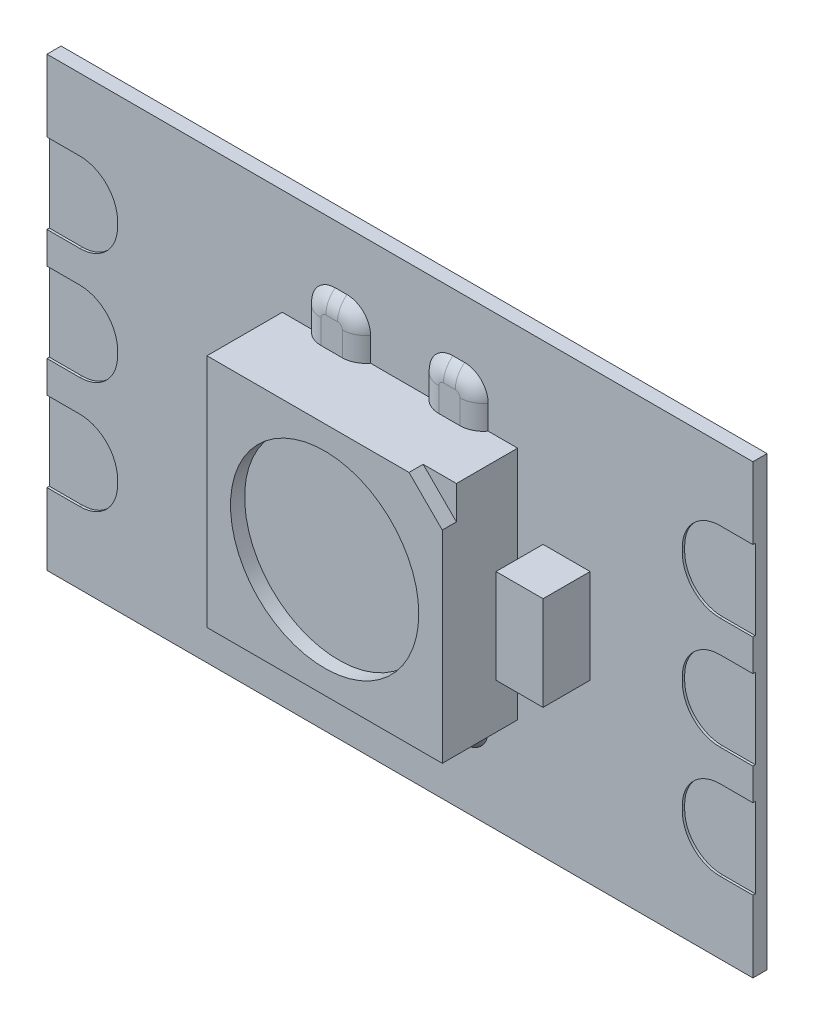
from build123d import *

# Parameters (mm, degrees)
ESQUISSE1_W             = 15
ESQUISSE1_H             = 9.5
BOSS_EXTRU_1_DEPTH      = 0.3
ESQUISSE2_W             = 5
ESQUISSE2_H             = 5
BOSS_EXTRU_2_DEPTH      = 1.6
ESQUISSE3_R             = 2
ENL_V_MAT_EXTRU_1_DEPTH = 0.3
BOSS_EXTRU_3_DEPTH      = 0.2
CONG_1_R                = 0.5
ENL_V_MAT_EXTRU_2_DEPTH = 0.05
ESQUISSE6_W             = 1
ESQUISSE6_H             = 2
BOSS_EXTRU_4_DEPTH      = 1


with BuildPart() as part:
    # Esquisse1 → Boss.-Extru.1 (new body)
    with BuildSketch(Plane.XY):
        with Locations((7.5, 4.75)):
            Rectangle(ESQUISSE1_W, ESQUISSE1_H)
    extrude(amount=BOSS_EXTRU_1_DEPTH)

    # Esquisse2 → Boss.-Extru.2 (add)
    with BuildSketch(Plane.XY.offset(0.3)):
        with Locations((7.5, 4.75)):
            Rectangle(ESQUISSE2_W, ESQUISSE2_H)
    extrude(amount=BOSS_EXTRU_2_DEPTH)

    # Esquisse3 → Enlèv. mat.-Extru.1 (cut)
    with BuildSketch(Plane.XY.offset(1.9)):
        with Locations((7.5, 4.75)):
            Circle(ESQUISSE3_R)
        Polygon((9.292893219, 7.25), (10, 6.542893219), (10, 7.25), align=None)
    extrude(amount=-ENL_V_MAT_EXTRU_1_DEPTH, mode=Mode.SUBTRACT)

    # Esquisse4 → Boss.-Extru.3 (add)
    with BuildSketch(Plane.XY.offset(0.3)):
        with BuildLine():
            Line((8.875, 8.263238259), (8.625, 8.263238259))
            ThreePointArc((8.625, 8.263238259), (8.271446609, 8.11679165), (8.125, 7.763238259))
            Line((8.125, 7.763238259), (8.125, 7.25))
            Line((8.125, 7.25), (9.375, 7.25))
            Line((9.375, 7.25), (9.375, 7.763238259))
            ThreePointArc((9.375, 7.763238259), (9.228553391, 8.11679165), (8.875, 8.263238259))
        make_face()
        with BuildLine():
            Line((5.625, 7.25), (6.875, 7.25))
            Line((6.875, 7.25), (6.875, 7.763238259))
            ThreePointArc((6.875, 7.763238259), (6.728553391, 8.11679165), (6.375, 8.263238259))
            Line((6.375, 8.263238259), (6.125, 8.263238259))
            ThreePointArc((6.125, 8.263238259), (5.771446609, 8.11679165), (5.625, 7.763238259))
            Line((5.625, 7.763238259), (5.625, 7.25))
        make_face()
        with BuildLine():
            Line((9.375, 2.25), (9.375, 1.736761741))
            ThreePointArc((9.375, 1.736761741), (9.228553391, 1.38320835), (8.875, 1.236761741))
            Line((8.875, 1.236761741), (8.625, 1.236761741))
            ThreePointArc((8.625, 1.236761741), (8.271446609, 1.38320835), (8.125, 1.736761741))
            Line((8.125, 1.736761741), (8.125, 2.25))
            Line((8.125, 2.25), (9.375, 2.25))
        make_face()
        with BuildLine():
            Line((6.125, 1.236761741), (6.375, 1.236761741))
            ThreePointArc((6.375, 1.236761741), (6.728553391, 1.38320835), (6.875, 1.736761741))
            Line((6.875, 1.736761741), (6.875, 2.25))
            Line((6.875, 2.25), (5.625, 2.25))
            Line((5.625, 2.25), (5.625, 1.736761741))
            ThreePointArc((5.625, 1.736761741), (5.771446609, 1.38320835), (6.125, 1.236761741))
        make_face()
    extrude(amount=BOSS_EXTRU_3_DEPTH)

    # Congé1
    # the kernel refuses this fillet: 0.5 mm, written as the material it takes off along each edge
    with BuildSketch(Plane(origin=(8.125, 1.736761741, 0.5), x_dir=(2.6165736243852198e-11, 0, -1.0), z_dir=(0, 1, 0)), Plane(origin=(9.375, 2.25, 0.5), x_dir=(-2.6165736243852198e-11, 0, -1.0), z_dir=(0, -1, 0))) as cong_1_piece_1:
        with BuildLine():
            CenterArc((0.5, -0.4), CONG_1_R, 126.869897647, 53.130102355)
            Line((0, -0.4), (-0.01, -0.4))
            Line((-0.01, -0.4), (-0.01, 0))
            Line((-0.01, 0), (0, 0.01))
            ThreePointArc((0, 0.01), (0.1, 0.01), (0.194, 0.008))
            Line((0.194, 0.008), (0.2, 0))
        make_face()
    extrude(amount=0.513238259, mode=Mode.SUBTRACT)
    with BuildSketch(Plane(origin=(8.625, 1.736761741, 0.5), x_dir=(0, -1, 0), z_dir=(1, 0, 0))) as cong_1_piece_2:
        with BuildLine():
            CenterArc((0.1, 0.5), CONG_1_R, 270, 53.130102355)
            Line((0.1, 0), (0.1, -0.01))
            Line((0.1, -0.01), (0.5, -0.01))
            Line((0.5, -0.01), (0.51, 0))
            ThreePointArc((0.51, 0), (0.51, 0.1), (0.508, 0.194))
            Line((0.508, 0.194), (0.5, 0.2))
        make_face()
    revolve(axis=Axis((8.625, 1.736761741, 0.5), (0, 0, -1)), revolution_arc=90, mode=Mode.SUBTRACT)
    with BuildSketch(Plane(origin=(8.875, 1.236761741, 0.5), x_dir=(0, 2.6109114869598534e-11, -1.0), z_dir=(-1, 0, 0))) as cong_1_piece_3:
        with BuildLine():
            CenterArc((0.5, -0.4), CONG_1_R, 126.869897647, 53.130102355)
            Line((0, -0.4), (-0.01, -0.4))
            Line((-0.01, -0.4), (-0.01, 0))
            Line((-0.01, 0), (0, 0.01))
            ThreePointArc((0, 0.01), (0.1, 0.01), (0.194, 0.008))
            Line((0.194, 0.008), (0.2, 0))
        make_face()
    extrude(amount=0.25, mode=Mode.SUBTRACT)
    with BuildSketch(Plane(origin=(5.625, 2.25, 0.5), x_dir=(2.6059154833492393e-11, 0, -1.0), z_dir=(0, -1, 0)), Plane(origin=(6.875, 1.736761741, 0.5), x_dir=(-2.6112445538672294e-11, 0, -1.0), z_dir=(0, 1, 0)), Plane(origin=(6.875, 7.25, 0.5), x_dir=(-2.6112445538672294e-11, 0, -1.0), z_dir=(0, 1, 0)), Plane(origin=(5.625, 7.763238259, 0.5), x_dir=(2.6059154833492393e-11, 0, -1.0), z_dir=(0, -1, 0)), Plane(origin=(9.375, 7.25, 0.5), x_dir=(-2.6165736243852198e-11, 0, -1.0), z_dir=(0, 1, 0)), Plane(origin=(8.125, 7.763238259, 0.5), x_dir=(2.6165736243852198e-11, 0, -1.0), z_dir=(0, -1, 0))) as cong_1_piece_4:
        with BuildLine():
            CenterArc((0.5, 0.4), CONG_1_R, 179.999999999, 53.130102355)
            Line((0, 0.4), (-0.01, 0.4))
            Line((-0.01, 0.4), (-0.01, 0))
            Line((-0.01, 0), (0, -0.01))
            ThreePointArc((0, -0.01), (0.1, -0.01), (0.194, -0.008))
            Line((0.194, -0.008), (0.2, 0))
        make_face()
    extrude(amount=0.513238259, mode=Mode.SUBTRACT)
    with BuildSketch(Plane(origin=(6.125, 1.736761741, 0.5), x_dir=(-1, 0, 0), z_dir=(0, 1, 0))) as cong_1_piece_5:
        with BuildLine():
            CenterArc((0.1, -0.5), CONG_1_R, 36.869897645, 53.130102355)
            Line((0.1, 0), (0.1, 0.01))
            Line((0.1, 0.01), (0.5, 0.01))
            Line((0.5, 0.01), (0.51, 0))
            ThreePointArc((0.51, 0), (0.51, -0.1), (0.508, -0.194))
            Line((0.508, -0.194), (0.5, -0.2))
        make_face()
    revolve(axis=Axis((6.125, 1.736761741, 0.5), (0, 0, 1)), revolution_arc=90, mode=Mode.SUBTRACT)
    with BuildSketch(Plane(origin=(6.125, 1.236761741, 0.5), x_dir=(0, 2.6109114869598534e-11, -1.0), z_dir=(1, 0, 0)), Plane(origin=(6.375, 8.263238259, 0.5), x_dir=(0, -2.6112445538672342e-11, -1.0), z_dir=(-1, 0, 0)), Plane(origin=(8.875, 8.263238259, 0.5), x_dir=(0, -2.6112445538672342e-11, -1.0), z_dir=(-1, 0, 0))) as cong_1_piece_6:
        with BuildLine():
            CenterArc((0.5, 0.4), CONG_1_R, 179.999999999, 53.130102355)
            Line((0, 0.4), (-0.01, 0.4))
            Line((-0.01, 0.4), (-0.01, 0))
            Line((-0.01, 0), (0, -0.01))
            ThreePointArc((0, -0.01), (0.1, -0.01), (0.194, -0.008))
            Line((0.194, -0.008), (0.2, 0))
        make_face()
    extrude(amount=0.25, mode=Mode.SUBTRACT)
    with BuildSketch(Plane(origin=(6.125, 7.763238259, 0.5), x_dir=(0, 1, 0), z_dir=(1, 0, 0))) as cong_1_piece_7:
        with BuildLine():
            CenterArc((0.1, -0.5), CONG_1_R, 36.869897645, 53.130102355)
            Line((0.1, 0), (0.1, 0.01))
            Line((0.1, 0.01), (0.5, 0.01))
            Line((0.5, 0.01), (0.51, 0))
            ThreePointArc((0.51, 0), (0.51, -0.1), (0.508, -0.194))
            Line((0.508, -0.194), (0.5, -0.2))
        make_face()
    revolve(axis=Axis((6.125, 7.763238259, 0.5), (0, 0, 1)), revolution_arc=90, mode=Mode.SUBTRACT)
    with BuildSketch(Plane(origin=(8.875, 7.763238259, 0.5), x_dir=(1, 0, 0), z_dir=(0, -1, 0))) as cong_1_piece_8:
        with BuildLine():
            CenterArc((0.1, -0.5), CONG_1_R, 36.869897645, 53.130102355)
            Line((0.1, 0), (0.1, 0.01))
            Line((0.1, 0.01), (0.5, 0.01))
            Line((0.5, 0.01), (0.51, 0))
            ThreePointArc((0.51, 0), (0.51, -0.1), (0.508, -0.194))
            Line((0.508, -0.194), (0.5, -0.2))
        make_face()
    revolve(axis=Axis((8.875, 7.763238259, 0.5), (0, 0, 1)), revolution_arc=90, mode=Mode.SUBTRACT)
    with BuildSketch(Plane(origin=(8.875, 1.736761741, 0.5), x_dir=(1, 0, 0), z_dir=(0, 1, 0))) as cong_1_piece_9:
        with BuildLine():
            CenterArc((0.1, 0.5), CONG_1_R, 270, 53.130102355)
            Line((0.1, 0), (0.1, -0.01))
            Line((0.1, -0.01), (0.5, -0.01))
            Line((0.5, -0.01), (0.51, 0))
            ThreePointArc((0.51, 0), (0.51, 0.1), (0.508, 0.194))
            Line((0.508, 0.194), (0.5, 0.2))
        make_face()
    revolve(axis=Axis((8.875, 1.736761741, 0.5), (0, 0, -1)), revolution_arc=90, mode=Mode.SUBTRACT)
    with BuildSketch(Plane(origin=(6.375, 1.736761741, 0.5), x_dir=(0, -1, 0), z_dir=(-1, 0, 0))) as cong_1_piece_10:
        with BuildLine():
            CenterArc((0.1, -0.5), CONG_1_R, 36.869897645, 53.130102355)
            Line((0.1, 0), (0.1, 0.01))
            Line((0.1, 0.01), (0.5, 0.01))
            Line((0.5, 0.01), (0.51, 0))
            ThreePointArc((0.51, 0), (0.51, -0.1), (0.508, -0.194))
            Line((0.508, -0.194), (0.5, -0.2))
        make_face()
    revolve(axis=Axis((6.375, 1.736761741, 0.5), (0, 0, 1)), revolution_arc=90, mode=Mode.SUBTRACT)
    with BuildSketch(Plane(origin=(6.375, 7.763238259, 0.5), x_dir=(1, 0, 0), z_dir=(0, -1, 0))) as cong_1_piece_11:
        with BuildLine():
            CenterArc((0.1, -0.5), CONG_1_R, 36.869897645, 53.130102355)
            Line((0.1, 0), (0.1, 0.01))
            Line((0.1, 0.01), (0.5, 0.01))
            Line((0.5, 0.01), (0.51, 0))
            ThreePointArc((0.51, 0), (0.51, -0.1), (0.508, -0.194))
            Line((0.508, -0.194), (0.5, -0.2))
        make_face()
    revolve(axis=Axis((6.375, 7.763238259, 0.5), (0, 0, 1)), revolution_arc=90, mode=Mode.SUBTRACT)
    with BuildSketch(Plane(origin=(8.625, 7.763238259, 0.5), x_dir=(0, 1, 0), z_dir=(1, 0, 0))) as cong_1_piece_12:
        with BuildLine():
            CenterArc((0.1, -0.5), CONG_1_R, 36.869897645, 53.130102355)
            Line((0.1, 0), (0.1, 0.01))
            Line((0.1, 0.01), (0.5, 0.01))
            Line((0.5, 0.01), (0.51, 0))
            ThreePointArc((0.51, 0), (0.51, -0.1), (0.508, -0.194))
            Line((0.508, -0.194), (0.5, -0.2))
        make_face()
    revolve(axis=Axis((8.625, 7.763238259, 0.5), (0, 0, 1)), revolution_arc=90, mode=Mode.SUBTRACT)

    # Esquisse5 → Enlèv. mat.-Extru.2 (cut)
    with BuildSketch(Plane.XY.offset(0.3)):
        with BuildLine():
            Line((-1.5, 1.525), (0.7, 1.525))
            ThreePointArc((0.7, 1.525), (1.265685425, 1.759314575), (1.5, 2.325))
            Line((1.5, 2.325), (1.5, 2.425))
            ThreePointArc((1.5, 2.425), (1.265685425, 2.990685425), (0.7, 3.225))
            Line((0.7, 3.225), (-1.5, 3.225))
            Line((-1.5, 3.225), (-1.5, 1.525))
        make_face()
        with BuildLine():
            Line((-1.5, 3.9), (0.7, 3.9))
            ThreePointArc((0.7, 3.9), (1.265685425, 4.134314575), (1.5, 4.7))
            Line((1.5, 4.7), (1.5, 4.8))
            ThreePointArc((1.5, 4.8), (1.265685425, 5.365685425), (0.7, 5.6))
            Line((0.7, 5.6), (-1.5, 5.6))
            Line((-1.5, 5.6), (-1.5, 3.9))
        make_face()
        with BuildLine():
            Line((-1.5, 6.275), (0.7, 6.275))
            ThreePointArc((0.7, 6.275), (1.265685425, 6.509314575), (1.5, 7.075))
            Line((1.5, 7.075), (1.5, 7.175))
            ThreePointArc((1.5, 7.175), (1.265685425, 7.740685425), (0.7, 7.975))
            Line((0.7, 7.975), (-1.5, 7.975))
            Line((-1.5, 7.975), (-1.5, 6.275))
        make_face()
        with BuildLine():
            Line((16.5, 3.225), (16.5, 1.525))
            Line((16.5, 1.525), (14.3, 1.525))
            ThreePointArc((14.3, 1.525), (13.734314575, 1.759314575), (13.5, 2.325))
            Line((13.5, 2.325), (13.5, 2.425))
            ThreePointArc((13.5, 2.425), (13.734314575, 2.990685425), (14.3, 3.225))
            Line((14.3, 3.225), (16.5, 3.225))
        make_face()
        with BuildLine():
            Line((16.5, 5.6), (14.3, 5.6))
            ThreePointArc((14.3, 5.6), (13.734314575, 5.365685425), (13.5, 4.8))
            Line((13.5, 4.8), (13.5, 4.7))
            ThreePointArc((13.5, 4.7), (13.734314575, 4.134314575), (14.3, 3.9))
            Line((14.3, 3.9), (16.5, 3.9))
            Line((16.5, 3.9), (16.5, 5.6))
        make_face()
        with BuildLine():
            Line((16.5, 7.975), (14.3, 7.975))
            ThreePointArc((14.3, 7.975), (13.734314575, 7.740685425), (13.5, 7.175))
            Line((13.5, 7.175), (13.5, 7.075))
            ThreePointArc((13.5, 7.075), (13.734314575, 6.509314575), (14.3, 6.275))
            Line((14.3, 6.275), (16.5, 6.275))
            Line((16.5, 6.275), (16.5, 7.975))
        make_face()
    extrude(amount=-ENL_V_MAT_EXTRU_2_DEPTH, mode=Mode.SUBTRACT)

    # Esquisse6 → Boss.-Extru.4 (add)
    with BuildSketch(Plane.XY.offset(0.3)):
        with Locations((11.04087009, 4.75)):
            Rectangle(ESQUISSE6_W, ESQUISSE6_H)
    extrude(amount=BOSS_EXTRU_4_DEPTH)


solid = part.part
